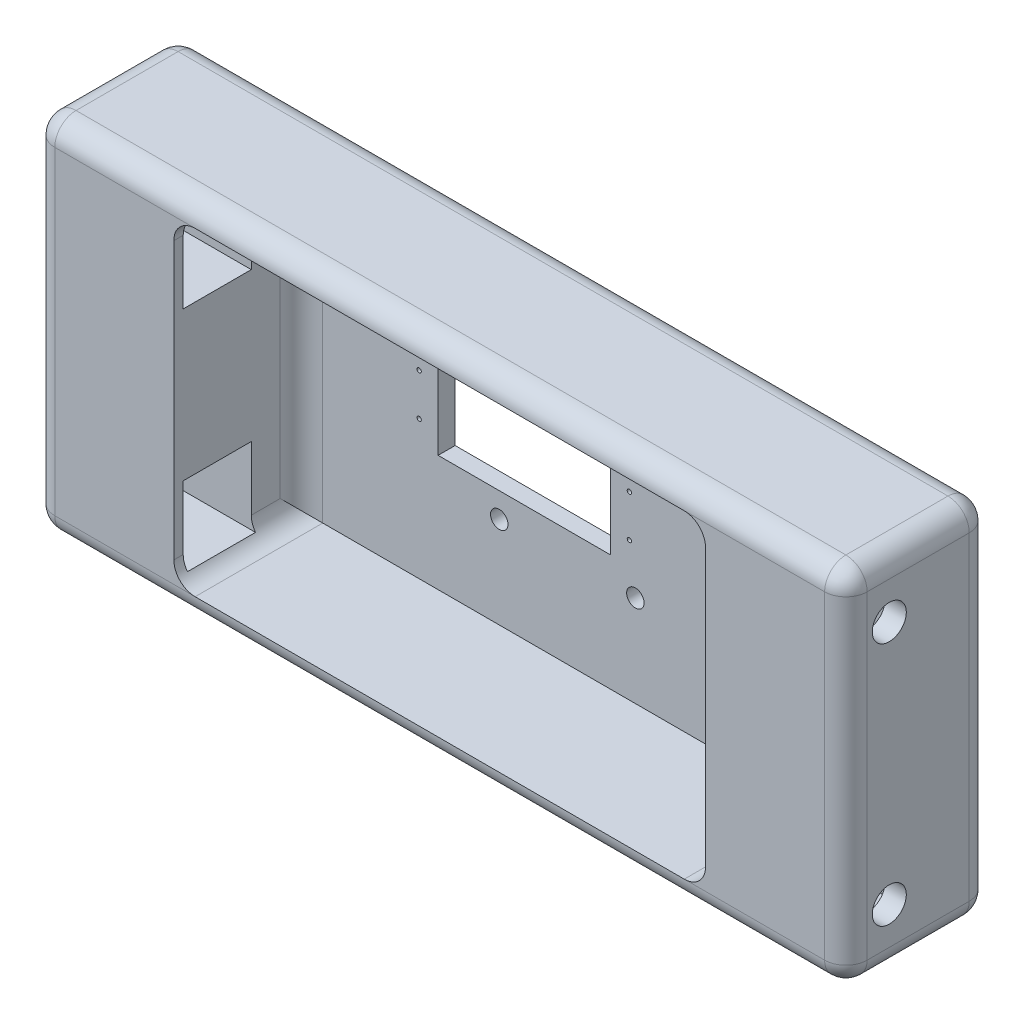
from build123d import *

# Parameters (mm, degrees)
ESBO_O1_W                 = 191
ESBO_O1_H                 = 85
ESBO_O1_W_2               = 125
ESBO_O1_H_2               = 75
RESSALTO_EXTRUS_O1_DEPTH  = 15
CORTE_EXTRUS_O1_REACH     = 198.245
ESBO_O2_R                 = 4
ESBO_O3_W                 = 16
ESBO_O3_H                 = 18
CORTE_EXTRUS_O2_DEPTH     = 28
ESPELHAR3_COPY_1_SKETCH_W = 16
ESPELHAR3_COPY_1_SKETCH_H = 18
ESPELHAR3_COPY_1_DEPTH    = 28
ESBO_O4_W                 = 191
ESBO_O4_H                 = 85
ESBO_O4_R                 = 0.5
ESBO_O4_W_2               = 40.5
ESBO_O4_H_2               = 20.3
RESSALTO_EXTRUS_O5_DEPTH  = 4
FILETE1_R                 = 5
ESBO_O5_R                 = 2.05
CORTE_EXTRUS_O3_DEPTH     = 4


with BuildPart() as part:
    # Esboço1 → Ressalto-extrusão1 (new, symmetric)
    with BuildSketch(Plane.XY):
        Rectangle(ESBO_O1_W, ESBO_O1_H)
        Rectangle(ESBO_O1_W_2, ESBO_O1_H_2, mode=Mode.SUBTRACT)
    extrude(amount=RESSALTO_EXTRUS_O1_DEPTH, both=True)

    # Corte-extrusão1: up to this face of the body (flat: up to its plane)
    corte_extrus_o1_end = Plane(part.part.faces().sort_by_distance((95.5, 0, 0))[0])
    # Esboço2 → Corte-extrusão1 (cut, up to the picked face)
    with BuildSketch(Plane.ZY.offset(95.5), mode=Mode.PRIVATE) as corte_extrus_o1_sk1:
        with Locations((4.8, -28.75)):
            Circle(ESBO_O2_R)
    corte_extrus_o1_tool1 = split(extrude(corte_extrus_o1_sk1.sketch, amount=-CORTE_EXTRUS_O1_REACH, mode=Mode.PRIVATE), bisect_by=corte_extrus_o1_end, keep=Keep.BOTH, mode=Mode.PRIVATE)
    corte_extrus_o1 = corte_extrus_o1_tool1.solids().sort_by(Axis((-95.5, -28.75, 4.8), (1, 0, 0)))[0]
    add(corte_extrus_o1, mode=Mode.SUBTRACT)

    # Esboço3 → Corte-extrusão2 (cut)
    with BuildSketch(Plane(origin=(-62.5, 0, 0), x_dir=(0, 0, -1), z_dir=(1, 0, 0))):
        with Locations((-4.8, -26.5)):
            Rectangle(ESBO_O3_W, ESBO_O3_H)
    corte_extrus_o2 = extrude(amount=-CORTE_EXTRUS_O2_DEPTH, mode=Mode.SUBTRACT)

    # Espelhar1: Corte-extrusão1 across plane
    add(corte_extrus_o1.mirror(Plane.ZX), mode=Mode.SUBTRACT)

    # Espelhar2: Corte-extrusão2 across plane
    add(corte_extrus_o2.mirror(Plane.ZX), mode=Mode.SUBTRACT)

    # Espelhar3: Corte-extrusão2 across plane
    add(corte_extrus_o2.mirror(Plane(origin=(0, 0, 0), x_dir=(0, 0, 1), z_dir=(1, 0, 0))), mode=Mode.SUBTRACT)

    # Espelhar3 copy 1 sketch → Espelhar3 copy 1 (cut)
    with BuildSketch(Plane(origin=(62.5, 0, 0), x_dir=(0, 0, -1), z_dir=(-1, 0, 0))):
        with Locations((-4.8, -26.5)):
            Rectangle(ESPELHAR3_COPY_1_SKETCH_W, ESPELHAR3_COPY_1_SKETCH_H)
    extrude(amount=-ESPELHAR3_COPY_1_DEPTH, mode=Mode.SUBTRACT)

    # Esboço4 → Ressalto-extrusão5 (add)
    with BuildSketch(Plane(origin=(0, 0, -15), x_dir=(-1, 0, 0), z_dir=(0, 0, -1))):
        Rectangle(ESBO_O4_W, ESBO_O4_H)
        with Locations((-14.59, -4.925)):
            Circle(ESBO_O4_R, mode=Mode.SUBTRACT)
        with Locations((34.83, -4.925)):
            Circle(ESBO_O4_R, mode=Mode.SUBTRACT)
        with Locations((34.83, 4.925)):
            Circle(ESBO_O4_R, mode=Mode.SUBTRACT)
        with Locations((-14.59, 4.925)):
            Circle(ESBO_O4_R, mode=Mode.SUBTRACT)
        with Locations((10.12, 0)):
            Rectangle(ESBO_O4_W_2, ESBO_O4_H_2, mode=Mode.SUBTRACT)
    extrude(amount=RESSALTO_EXTRUS_O5_DEPTH)

    # Filete1
    # the kernel refuses this fillet: 5 mm, written as the material it adds along each edge
    with BuildSketch(Plane(origin=(57.5, 32.5, -10), x_dir=(0, 1, 0), z_dir=(0, 0, -1))) as filete1_piece_1_section:
        Polygon((0, 0), (FILETE1_R, 0), (FILETE1_R, FILETE1_R), (0, FILETE1_R), align=None)
    filete1_piece_1 = extrude(amount=FILETE1_R, mode=Mode.PRIVATE)
    filete1_piece_1 = filete1_piece_1 - Plane(origin=(57.5, 32.5, -10), x_dir=(-0.7071067811865475, -0.7071067811865475, 0), z_dir=(0, 0, -1)) * Sphere(FILETE1_R, mode=Mode.PRIVATE)
    add(filete1_piece_1)
    with BuildSketch(Plane(origin=(-57.5, 32.5, -10), x_dir=(0, 1, 0), z_dir=(0, 0, -1))) as filete1_piece_2_section:
        Polygon((0, 0), (FILETE1_R, 0), (FILETE1_R, -FILETE1_R), (0, -FILETE1_R), align=None)
    filete1_piece_2 = extrude(amount=FILETE1_R, mode=Mode.PRIVATE)
    filete1_piece_2 = filete1_piece_2 - Plane(origin=(-57.5, 32.5, -10), x_dir=(0.7071067811865475, -0.7071067811865475, 0), z_dir=(0, 0, -1)) * Sphere(FILETE1_R, mode=Mode.PRIVATE)
    add(filete1_piece_2)
    with BuildSketch(Plane(origin=(62.5, 37.5, -10), x_dir=(0, -1, 0), z_dir=(0, 0, 1))) as filete1_piece_3_section:
        with BuildLine():
            CenterArc((FILETE1_R, -FILETE1_R), FILETE1_R, 90, 90)
            Line((0, -FILETE1_R), (0, 0))
            Line((0, 0), (FILETE1_R, 0))
        make_face()
    filete1_piece_3 = extrude(amount=25, mode=Mode.PRIVATE)
    filete1_piece_3 = split(filete1_piece_3, bisect_by=Plane(origin=(62.288112528, 34.58294172, -3.2), z_dir=(0, 0, -1)), keep=Keep.TOP, mode=Mode.PRIVATE)
    filete1_piece_3 = split(filete1_piece_3, bisect_by=Plane(origin=(62.288112528, 35.5, -6.6), z_dir=(0, -1, 0)), keep=Keep.TOP, mode=Mode.PRIVATE)
    add(filete1_piece_3)
    with BuildSketch(Plane(origin=(62.5, 37.5, -10), x_dir=(0, -1, 0), z_dir=(0, 0, 1))) as filete1_piece_4_section:
        with BuildLine():
            CenterArc((FILETE1_R, -FILETE1_R), FILETE1_R, 90, 90)
            Line((0, -FILETE1_R), (0, 0))
            Line((0, 0), (FILETE1_R, 0))
        make_face()
    filete1_piece_4 = extrude(amount=25, mode=Mode.PRIVATE)
    filete1_piece_4 = split(filete1_piece_4, bisect_by=Plane(origin=(61.14222039, 36.806111701, -3.2), z_dir=(0, 0, -1)), keep=Keep.TOP, mode=Mode.PRIVATE)
    filete1_piece_4 = split(filete1_piece_4, bisect_by=Plane(origin=(61.14222039, 35.5, -6.6), z_dir=(0, 1, 0)), keep=Keep.TOP, mode=Mode.PRIVATE)
    add(filete1_piece_4)
    with BuildSketch(Plane(origin=(62.5, 37.5, -10), x_dir=(0, -1, 0), z_dir=(0, 0, 1))) as filete1_piece_5_section:
        with BuildLine():
            CenterArc((FILETE1_R, -FILETE1_R), FILETE1_R, 90, 90)
            Line((0, -FILETE1_R), (0, 0))
            Line((0, 0), (FILETE1_R, 0))
        make_face()
    filete1_piece_5 = extrude(amount=25, mode=Mode.PRIVATE)
    filete1_piece_5 = split(filete1_piece_5, bisect_by=Plane(origin=(61.14222039, 36.806111701, 12.8), z_dir=(0, 0, -1)), keep=Keep.TOP, mode=Mode.PRIVATE)
    filete1_piece_5 = split(filete1_piece_5, bisect_by=Plane(origin=(61.14222039, 36.806111701, -3.2), z_dir=(0, 0, 1)), keep=Keep.TOP, mode=Mode.PRIVATE)
    filete1_piece_5 = split(filete1_piece_5, bisect_by=Plane(origin=(61.14222039, 35.5, 4.8), z_dir=(0, 1, 0)), keep=Keep.TOP, mode=Mode.PRIVATE)
    add(filete1_piece_5)
    with BuildSketch(Plane(origin=(62.5, 37.5, -10), x_dir=(0, -1, 0), z_dir=(0, 0, 1))) as filete1_piece_6_section:
        with BuildLine():
            CenterArc((FILETE1_R, -FILETE1_R), FILETE1_R, 90, 90)
            Line((0, -FILETE1_R), (0, 0))
            Line((0, 0), (FILETE1_R, 0))
        make_face()
    filete1_piece_6 = extrude(amount=25, mode=Mode.PRIVATE)
    filete1_piece_6 = split(filete1_piece_6, bisect_by=Plane(origin=(62.288112528, 34.58294172, 12.8), z_dir=(0, 0, 1)), keep=Keep.TOP, mode=Mode.PRIVATE)
    filete1_piece_6 = split(filete1_piece_6, bisect_by=Plane(origin=(62.288112528, 35.5, 13.9), z_dir=(0, -1, 0)), keep=Keep.TOP, mode=Mode.PRIVATE)
    add(filete1_piece_6)
    with BuildSketch(Plane(origin=(62.5, 37.5, -10), x_dir=(0, -1, 0), z_dir=(0, 0, 1))) as filete1_piece_7_section:
        with BuildLine():
            CenterArc((FILETE1_R, -FILETE1_R), FILETE1_R, 90, 90)
            Line((0, -FILETE1_R), (0, 0))
            Line((0, 0), (FILETE1_R, 0))
        make_face()
    filete1_piece_7 = extrude(amount=25, mode=Mode.PRIVATE)
    filete1_piece_7 = split(filete1_piece_7, bisect_by=Plane(origin=(61.14222039, 36.806111701, 12.8), z_dir=(0, 0, 1)), keep=Keep.TOP, mode=Mode.PRIVATE)
    filete1_piece_7 = split(filete1_piece_7, bisect_by=Plane(origin=(61.14222039, 35.5, 13.9), z_dir=(0, 1, 0)), keep=Keep.TOP, mode=Mode.PRIVATE)
    add(filete1_piece_7)
    with BuildSketch(Plane(origin=(-62.5, 37.5, -10), x_dir=(1, 0, 0), z_dir=(0, 0, 1))) as filete1_piece_8_section:
        with BuildLine():
            CenterArc((FILETE1_R, -FILETE1_R), FILETE1_R, 90, 90)
            Line((0, -FILETE1_R), (0, 0))
            Line((0, 0), (FILETE1_R, 0))
        make_face()
    filete1_piece_8 = extrude(amount=25, mode=Mode.PRIVATE)
    filete1_piece_8 = split(filete1_piece_8, bisect_by=Plane(origin=(-61.14222039, 35.5, -6.6), z_dir=(0, 1, 0)), keep=Keep.TOP, mode=Mode.PRIVATE)
    filete1_piece_8 = split(filete1_piece_8, bisect_by=Plane(origin=(-61.14222039, 36.806111701, -3.2), z_dir=(0, 0, -1)), keep=Keep.TOP, mode=Mode.PRIVATE)
    add(filete1_piece_8)
    with BuildSketch(Plane(origin=(-62.5, 37.5, -10), x_dir=(1, 0, 0), z_dir=(0, 0, 1))) as filete1_piece_9_section:
        with BuildLine():
            CenterArc((FILETE1_R, -FILETE1_R), FILETE1_R, 90, 90)
            Line((0, -FILETE1_R), (0, 0))
            Line((0, 0), (FILETE1_R, 0))
        make_face()
    filete1_piece_9 = extrude(amount=25, mode=Mode.PRIVATE)
    filete1_piece_9 = split(filete1_piece_9, bisect_by=Plane(origin=(-62.288112528, 35.5, -6.6), z_dir=(0, -1, 0)), keep=Keep.TOP, mode=Mode.PRIVATE)
    filete1_piece_9 = split(filete1_piece_9, bisect_by=Plane(origin=(-62.288112528, 34.58294172, -3.2), z_dir=(0, 0, -1)), keep=Keep.TOP, mode=Mode.PRIVATE)
    add(filete1_piece_9)
    with BuildSketch(Plane(origin=(-62.5, 37.5, -10), x_dir=(1, 0, 0), z_dir=(0, 0, 1))) as filete1_piece_10_section:
        with BuildLine():
            CenterArc((FILETE1_R, -FILETE1_R), FILETE1_R, 90, 90)
            Line((0, -FILETE1_R), (0, 0))
            Line((0, 0), (FILETE1_R, 0))
        make_face()
    filete1_piece_10 = extrude(amount=25, mode=Mode.PRIVATE)
    filete1_piece_10 = split(filete1_piece_10, bisect_by=Plane(origin=(-61.14222039, 35.5, 4.8), z_dir=(0, 1, 0)), keep=Keep.TOP, mode=Mode.PRIVATE)
    filete1_piece_10 = split(filete1_piece_10, bisect_by=Plane(origin=(-61.14222039, 36.806111701, -3.2), z_dir=(0, 0, 1)), keep=Keep.TOP, mode=Mode.PRIVATE)
    filete1_piece_10 = split(filete1_piece_10, bisect_by=Plane(origin=(-61.14222039, 36.806111701, 12.8), z_dir=(0, 0, -1)), keep=Keep.TOP, mode=Mode.PRIVATE)
    add(filete1_piece_10)
    with BuildSketch(Plane(origin=(-62.5, 37.5, -10), x_dir=(1, 0, 0), z_dir=(0, 0, 1))) as filete1_piece_11_section:
        with BuildLine():
            CenterArc((FILETE1_R, -FILETE1_R), FILETE1_R, 90, 90)
            Line((0, -FILETE1_R), (0, 0))
            Line((0, 0), (FILETE1_R, 0))
        make_face()
    filete1_piece_11 = extrude(amount=25, mode=Mode.PRIVATE)
    filete1_piece_11 = split(filete1_piece_11, bisect_by=Plane(origin=(-61.14222039, 35.5, 13.9), z_dir=(0, 1, 0)), keep=Keep.TOP, mode=Mode.PRIVATE)
    filete1_piece_11 = split(filete1_piece_11, bisect_by=Plane(origin=(-61.14222039, 36.806111701, 12.8), z_dir=(0, 0, 1)), keep=Keep.TOP, mode=Mode.PRIVATE)
    add(filete1_piece_11)
    with BuildSketch(Plane(origin=(-62.5, 37.5, -10), x_dir=(1, 0, 0), z_dir=(0, 0, 1))) as filete1_piece_12_section:
        with BuildLine():
            CenterArc((FILETE1_R, -FILETE1_R), FILETE1_R, 90, 90)
            Line((0, -FILETE1_R), (0, 0))
            Line((0, 0), (FILETE1_R, 0))
        make_face()
    filete1_piece_12 = extrude(amount=25, mode=Mode.PRIVATE)
    filete1_piece_12 = split(filete1_piece_12, bisect_by=Plane(origin=(-62.288112528, 35.5, 13.9), z_dir=(0, -1, 0)), keep=Keep.TOP, mode=Mode.PRIVATE)
    filete1_piece_12 = split(filete1_piece_12, bisect_by=Plane(origin=(-62.288112528, 34.58294172, 12.8), z_dir=(0, 0, 1)), keep=Keep.TOP, mode=Mode.PRIVATE)
    add(filete1_piece_12)
    with BuildSketch(Plane(origin=(57.5, 37.5, -15), x_dir=(0, 0, 1), z_dir=(-1, 0, 0))) as filete1_piece_13:
        with BuildLine():
            CenterArc((FILETE1_R, -FILETE1_R), FILETE1_R, 90, 90)
            Line((0, -FILETE1_R), (0, 0))
            Line((0, 0), (FILETE1_R, 0))
        make_face()
    extrude(amount=115)
    with BuildSketch(Plane(origin=(-62.5, 32.5, -15), x_dir=(0, 0, 1), z_dir=(0, -1, 0)), Plane(origin=(62.5, -37.5, -15), x_dir=(0, 0, 1), z_dir=(0, 1, 0))) as filete1_piece_14:
        with BuildLine():
            CenterArc((FILETE1_R, -FILETE1_R), FILETE1_R, 90, 90)
            Line((0, -FILETE1_R), (0, 0))
            Line((0, 0), (FILETE1_R, 0))
        make_face()
    extrude(amount=70)
    with BuildSketch(Plane(origin=(62.5, -37.5, -15), x_dir=(0, 1, 0), z_dir=(0, 0, 1))) as filete1_piece_15_section:
        with BuildLine():
            CenterArc((FILETE1_R, FILETE1_R), FILETE1_R, 180, 90)
            Line((0, FILETE1_R), (0, 0))
            Line((0, 0), (FILETE1_R, 0))
        make_face()
    filete1_piece_15 = extrude(amount=30, mode=Mode.PRIVATE)
    filete1_piece_15 = split(filete1_piece_15, bisect_by=Plane(origin=(62.288112528, -35.5, -9.1), z_dir=(0, 1, 0)), keep=Keep.TOP, mode=Mode.PRIVATE)
    filete1_piece_15 = split(filete1_piece_15, bisect_by=Plane(origin=(62.288112528, -34.58294172, -3.2), z_dir=(0, 0, -1)), keep=Keep.TOP, mode=Mode.PRIVATE)
    add(filete1_piece_15)
    with BuildSketch(Plane(origin=(62.5, -37.5, -15), x_dir=(0, 1, 0), z_dir=(0, 0, 1))) as filete1_piece_16_section:
        with BuildLine():
            CenterArc((FILETE1_R, FILETE1_R), FILETE1_R, 180, 90)
            Line((0, FILETE1_R), (0, 0))
            Line((0, 0), (FILETE1_R, 0))
        make_face()
    filete1_piece_16 = extrude(amount=30, mode=Mode.PRIVATE)
    filete1_piece_16 = split(filete1_piece_16, bisect_by=Plane(origin=(61.14222039, -35.5, -9.1), z_dir=(0, -1, 0)), keep=Keep.TOP, mode=Mode.PRIVATE)
    filete1_piece_16 = split(filete1_piece_16, bisect_by=Plane(origin=(61.14222039, -36.806111701, -3.2), z_dir=(0, 0, -1)), keep=Keep.TOP, mode=Mode.PRIVATE)
    add(filete1_piece_16)
    with BuildSketch(Plane(origin=(62.5, -37.5, -15), x_dir=(0, 1, 0), z_dir=(0, 0, 1))) as filete1_piece_17_section:
        with BuildLine():
            CenterArc((FILETE1_R, FILETE1_R), FILETE1_R, 180, 90)
            Line((0, FILETE1_R), (0, 0))
            Line((0, 0), (FILETE1_R, 0))
        make_face()
    filete1_piece_17 = extrude(amount=30, mode=Mode.PRIVATE)
    filete1_piece_17 = split(filete1_piece_17, bisect_by=Plane(origin=(61.14222039, -35.5, 4.8), z_dir=(0, -1, 0)), keep=Keep.TOP, mode=Mode.PRIVATE)
    filete1_piece_17 = split(filete1_piece_17, bisect_by=Plane(origin=(61.14222039, -36.806111701, 12.8), z_dir=(0, 0, -1)), keep=Keep.TOP, mode=Mode.PRIVATE)
    filete1_piece_17 = split(filete1_piece_17, bisect_by=Plane(origin=(61.14222039, -36.806111701, -3.2), z_dir=(0, 0, 1)), keep=Keep.TOP, mode=Mode.PRIVATE)
    add(filete1_piece_17)
    with BuildSketch(Plane(origin=(62.5, -37.5, -15), x_dir=(0, 1, 0), z_dir=(0, 0, 1))) as filete1_piece_18_section:
        with BuildLine():
            CenterArc((FILETE1_R, FILETE1_R), FILETE1_R, 180, 90)
            Line((0, FILETE1_R), (0, 0))
            Line((0, 0), (FILETE1_R, 0))
        make_face()
    filete1_piece_18 = extrude(amount=30, mode=Mode.PRIVATE)
    filete1_piece_18 = split(filete1_piece_18, bisect_by=Plane(origin=(62.288112528, -35.5, 13.9), z_dir=(0, 1, 0)), keep=Keep.TOP, mode=Mode.PRIVATE)
    filete1_piece_18 = split(filete1_piece_18, bisect_by=Plane(origin=(62.288112528, -34.58294172, 12.8), z_dir=(0, 0, 1)), keep=Keep.TOP, mode=Mode.PRIVATE)
    add(filete1_piece_18)
    with BuildSketch(Plane(origin=(62.5, -37.5, -15), x_dir=(0, 1, 0), z_dir=(0, 0, 1))) as filete1_piece_19_section:
        with BuildLine():
            CenterArc((FILETE1_R, FILETE1_R), FILETE1_R, 180, 90)
            Line((0, FILETE1_R), (0, 0))
            Line((0, 0), (FILETE1_R, 0))
        make_face()
    filete1_piece_19 = extrude(amount=30, mode=Mode.PRIVATE)
    filete1_piece_19 = split(filete1_piece_19, bisect_by=Plane(origin=(61.14222039, -35.5, 13.9), z_dir=(0, -1, 0)), keep=Keep.TOP, mode=Mode.PRIVATE)
    filete1_piece_19 = split(filete1_piece_19, bisect_by=Plane(origin=(61.14222039, -36.806111701, 12.8), z_dir=(0, 0, 1)), keep=Keep.TOP, mode=Mode.PRIVATE)
    add(filete1_piece_19)
    with BuildSketch(Plane(origin=(-62.5, -37.5, 15), x_dir=(0, 1, 0), z_dir=(0, 0, -1))) as filete1_piece_20_section:
        with BuildLine():
            CenterArc((FILETE1_R, FILETE1_R), FILETE1_R, 180, 90)
            Line((0, FILETE1_R), (0, 0))
            Line((0, 0), (FILETE1_R, 0))
        make_face()
    filete1_piece_20 = extrude(amount=30, mode=Mode.PRIVATE)
    filete1_piece_20 = split(filete1_piece_20, bisect_by=Plane(origin=(-62.288112528, -34.58294172, 12.8), z_dir=(0, 0, 1)), keep=Keep.TOP, mode=Mode.PRIVATE)
    filete1_piece_20 = split(filete1_piece_20, bisect_by=Plane(origin=(-62.288112528, -35.5, 13.9), z_dir=(0, 1, 0)), keep=Keep.TOP, mode=Mode.PRIVATE)
    add(filete1_piece_20)
    with BuildSketch(Plane(origin=(-62.5, -37.5, 15), x_dir=(0, 1, 0), z_dir=(0, 0, -1))) as filete1_piece_21_section:
        with BuildLine():
            CenterArc((FILETE1_R, FILETE1_R), FILETE1_R, 180, 90)
            Line((0, FILETE1_R), (0, 0))
            Line((0, 0), (FILETE1_R, 0))
        make_face()
    filete1_piece_21 = extrude(amount=30, mode=Mode.PRIVATE)
    filete1_piece_21 = split(filete1_piece_21, bisect_by=Plane(origin=(-61.14222039, -36.806111701, 12.8), z_dir=(0, 0, 1)), keep=Keep.TOP, mode=Mode.PRIVATE)
    filete1_piece_21 = split(filete1_piece_21, bisect_by=Plane(origin=(-61.14222039, -35.5, 13.9), z_dir=(0, -1, 0)), keep=Keep.TOP, mode=Mode.PRIVATE)
    add(filete1_piece_21)
    with BuildSketch(Plane(origin=(-62.5, -37.5, 15), x_dir=(0, 1, 0), z_dir=(0, 0, -1))) as filete1_piece_22_section:
        with BuildLine():
            CenterArc((FILETE1_R, FILETE1_R), FILETE1_R, 180, 90)
            Line((0, FILETE1_R), (0, 0))
            Line((0, 0), (FILETE1_R, 0))
        make_face()
    filete1_piece_22 = extrude(amount=30, mode=Mode.PRIVATE)
    filete1_piece_22 = split(filete1_piece_22, bisect_by=Plane(origin=(-61.14222039, -36.806111701, 12.8), z_dir=(0, 0, -1)), keep=Keep.TOP, mode=Mode.PRIVATE)
    filete1_piece_22 = split(filete1_piece_22, bisect_by=Plane(origin=(-61.14222039, -35.5, 4.8), z_dir=(0, -1, 0)), keep=Keep.TOP, mode=Mode.PRIVATE)
    filete1_piece_22 = split(filete1_piece_22, bisect_by=Plane(origin=(-61.14222039, -36.806111701, -3.2), z_dir=(0, 0, 1)), keep=Keep.TOP, mode=Mode.PRIVATE)
    add(filete1_piece_22)
    with BuildSketch(Plane(origin=(-62.5, -37.5, 15), x_dir=(0, 1, 0), z_dir=(0, 0, -1))) as filete1_piece_23_section:
        with BuildLine():
            CenterArc((FILETE1_R, FILETE1_R), FILETE1_R, 180, 90)
            Line((0, FILETE1_R), (0, 0))
            Line((0, 0), (FILETE1_R, 0))
        make_face()
    filete1_piece_23 = extrude(amount=30, mode=Mode.PRIVATE)
    filete1_piece_23 = split(filete1_piece_23, bisect_by=Plane(origin=(-62.288112528, -35.5, -9.1), z_dir=(0, 1, 0)), keep=Keep.TOP, mode=Mode.PRIVATE)
    filete1_piece_23 = split(filete1_piece_23, bisect_by=Plane(origin=(-62.288112528, -34.58294172, -3.2), z_dir=(0, 0, -1)), keep=Keep.TOP, mode=Mode.PRIVATE)
    add(filete1_piece_23)
    with BuildSketch(Plane(origin=(-62.5, -37.5, 15), x_dir=(0, 1, 0), z_dir=(0, 0, -1))) as filete1_piece_24_section:
        with BuildLine():
            CenterArc((FILETE1_R, FILETE1_R), FILETE1_R, 180, 90)
            Line((0, FILETE1_R), (0, 0))
            Line((0, 0), (FILETE1_R, 0))
        make_face()
    filete1_piece_24 = extrude(amount=30, mode=Mode.PRIVATE)
    filete1_piece_24 = split(filete1_piece_24, bisect_by=Plane(origin=(-61.14222039, -35.5, -9.1), z_dir=(0, -1, 0)), keep=Keep.TOP, mode=Mode.PRIVATE)
    filete1_piece_24 = split(filete1_piece_24, bisect_by=Plane(origin=(-61.14222039, -36.806111701, -3.2), z_dir=(0, 0, -1)), keep=Keep.TOP, mode=Mode.PRIVATE)
    add(filete1_piece_24)
    # the kernel refuses this fillet: 5 mm, written as the material it takes off along each edge
    with BuildSketch(Plane(origin=(90.5, -37.5, 10), x_dir=(1, 0, 0), z_dir=(0, -1, 0))) as filete1_2_piece_1_section:
        Polygon((0, 0), (FILETE1_R, 0), (FILETE1_R, FILETE1_R), (0, FILETE1_R), align=None)
    filete1_2_piece_1 = extrude(amount=FILETE1_R, mode=Mode.PRIVATE)
    filete1_2_piece_1 = filete1_2_piece_1 - Plane(origin=(90.5, -37.5, 10), x_dir=(-0.7071067811865475, 0, -0.7071067811865475), z_dir=(0, -1, 0)) * Sphere(FILETE1_R, mode=Mode.PRIVATE)
    add(filete1_2_piece_1, mode=Mode.SUBTRACT)
    with BuildSketch(Plane(origin=(90.5, 37.5, 10), x_dir=(1, 0, 0), z_dir=(0, 1, 0))) as filete1_2_piece_2_section:
        Polygon((0, 0), (FILETE1_R, 0), (FILETE1_R, -FILETE1_R), (0, -FILETE1_R), align=None)
    filete1_2_piece_2 = extrude(amount=FILETE1_R, mode=Mode.PRIVATE)
    filete1_2_piece_2 = filete1_2_piece_2 - Plane(origin=(90.5, 37.5, 10), x_dir=(-0.7071067811865475, 0, -0.7071067811865475), z_dir=(0, 1, 0)) * Sphere(FILETE1_R, mode=Mode.PRIVATE)
    add(filete1_2_piece_2, mode=Mode.SUBTRACT)
    with BuildSketch(Plane(origin=(-90.5, 37.5, 10), x_dir=(-1, 0, 0), z_dir=(0, 1, 0))) as filete1_2_piece_3_section:
        Polygon((0, 0), (FILETE1_R, 0), (FILETE1_R, FILETE1_R), (0, FILETE1_R), align=None)
    filete1_2_piece_3 = extrude(amount=FILETE1_R, mode=Mode.PRIVATE)
    filete1_2_piece_3 = filete1_2_piece_3 - Plane(origin=(-90.5, 37.5, 10), x_dir=(0.7071067811865475, 0, -0.7071067811865475), z_dir=(0, 1, 0)) * Sphere(FILETE1_R, mode=Mode.PRIVATE)
    add(filete1_2_piece_3, mode=Mode.SUBTRACT)
    with BuildSketch(Plane(origin=(-90.5, -37.5, 10), x_dir=(-1, 0, 0), z_dir=(0, -1, 0))) as filete1_2_piece_4_section:
        Polygon((0, 0), (FILETE1_R, 0), (FILETE1_R, -FILETE1_R), (0, -FILETE1_R), align=None)
    filete1_2_piece_4 = extrude(amount=FILETE1_R, mode=Mode.PRIVATE)
    filete1_2_piece_4 = filete1_2_piece_4 - Plane(origin=(-90.5, -37.5, 10), x_dir=(0.7071067811865475, 0, -0.7071067811865475), z_dir=(0, -1, 0)) * Sphere(FILETE1_R, mode=Mode.PRIVATE)
    add(filete1_2_piece_4, mode=Mode.SUBTRACT)
    with BuildSketch(Plane(origin=(90.5, -37.5, -14), x_dir=(1, 0, 0), z_dir=(0, -1, 0))) as filete1_2_piece_5_section:
        Polygon((0, 0), (FILETE1_R, 0), (FILETE1_R, -FILETE1_R), (0, -FILETE1_R), align=None)
    filete1_2_piece_5 = extrude(amount=FILETE1_R, mode=Mode.PRIVATE)
    filete1_2_piece_5 = filete1_2_piece_5 - Plane(origin=(90.5, -37.5, -14), x_dir=(-0.7071067811865475, 0, 0.7071067811865475), z_dir=(0, -1, 0)) * Sphere(FILETE1_R, mode=Mode.PRIVATE)
    add(filete1_2_piece_5, mode=Mode.SUBTRACT)
    with BuildSketch(Plane(origin=(90.5, 37.5, -14), x_dir=(1, 0, 0), z_dir=(0, 1, 0))) as filete1_2_piece_6_section:
        Polygon((0, 0), (FILETE1_R, 0), (FILETE1_R, FILETE1_R), (0, FILETE1_R), align=None)
    filete1_2_piece_6 = extrude(amount=FILETE1_R, mode=Mode.PRIVATE)
    filete1_2_piece_6 = filete1_2_piece_6 - Plane(origin=(90.5, 37.5, -14), x_dir=(-0.7071067811865475, 0, 0.7071067811865475), z_dir=(0, 1, 0)) * Sphere(FILETE1_R, mode=Mode.PRIVATE)
    add(filete1_2_piece_6, mode=Mode.SUBTRACT)
    with BuildSketch(Plane(origin=(-90.5, -37.5, -14), x_dir=(0, 0, -1), z_dir=(0, -1, 0))) as filete1_2_piece_7_section:
        Polygon((0, 0), (FILETE1_R, 0), (FILETE1_R, -FILETE1_R), (0, -FILETE1_R), align=None)
    filete1_2_piece_7 = extrude(amount=FILETE1_R, mode=Mode.PRIVATE)
    filete1_2_piece_7 = filete1_2_piece_7 - Plane(origin=(-90.5, -37.5, -14), x_dir=(0.7071067811865475, 0, 0.7071067811865475), z_dir=(0, -1, 0)) * Sphere(FILETE1_R, mode=Mode.PRIVATE)
    add(filete1_2_piece_7, mode=Mode.SUBTRACT)
    with BuildSketch(Plane(origin=(-90.5, 37.5, -14), x_dir=(0, 0, -1), z_dir=(0, 1, 0))) as filete1_2_piece_8_section:
        Polygon((0, 0), (FILETE1_R, 0), (FILETE1_R, FILETE1_R), (0, FILETE1_R), align=None)
    filete1_2_piece_8 = extrude(amount=FILETE1_R, mode=Mode.PRIVATE)
    filete1_2_piece_8 = filete1_2_piece_8 - Plane(origin=(-90.5, 37.5, -14), x_dir=(0.7071067811865475, 0, 0.7071067811865475), z_dir=(0, 1, 0)) * Sphere(FILETE1_R, mode=Mode.PRIVATE)
    add(filete1_2_piece_8, mode=Mode.SUBTRACT)
    with BuildSketch(Plane(origin=(95.5, -37.5, 15), x_dir=(0, 0, -1), z_dir=(0, 1, 0)), Plane(origin=(-95.5, 37.5, 15), x_dir=(0, 0, -1), z_dir=(0, -1, 0)), Plane(origin=(-95.5, 37.5, -19), x_dir=(1, 0, 0), z_dir=(0, -1, 0))) as filete1_2_piece_9:
        with BuildLine():
            CenterArc((FILETE1_R, FILETE1_R), FILETE1_R, 180, 90)
            Line((0, FILETE1_R), (0, 0))
            Line((0, 0), (FILETE1_R, 0))
        make_face()
    extrude(amount=75, mode=Mode.SUBTRACT)
    with BuildSketch(Plane(origin=(95.5, -37.5, -19), x_dir=(0, 0, 1), z_dir=(0, 1, 0))) as filete1_2_piece_10:
        with BuildLine():
            CenterArc((FILETE1_R, -FILETE1_R), FILETE1_R, 90, 90)
            Line((0, -FILETE1_R), (0, 0))
            Line((0, 0), (FILETE1_R, 0))
        make_face()
    extrude(amount=75, mode=Mode.SUBTRACT)
    with BuildSketch(Plane(origin=(-90.5, -42.5, -19), x_dir=(0, 0, 1), z_dir=(1, 0, 0)), Plane(origin=(90.5, 42.5, -19), x_dir=(0, 0, 1), z_dir=(-1, 0, 0))) as filete1_2_piece_11:
        with BuildLine():
            CenterArc((FILETE1_R, -FILETE1_R), FILETE1_R, 90, 90)
            Line((0, -FILETE1_R), (0, 0))
            Line((0, 0), (FILETE1_R, 0))
        make_face()
    extrude(amount=181, mode=Mode.SUBTRACT)
    with BuildSketch(Plane(origin=(-95.5, -42.5, 10), x_dir=(1, 0, 0), z_dir=(0, 0, -1)), Plane(origin=(95.5, -42.5, -14), x_dir=(-1, 0, 0), z_dir=(0, 0, 1)), Plane(origin=(95.5, 42.5, -14), x_dir=(0, -1, 0), z_dir=(0, 0, 1))) as filete1_2_piece_12:
        with BuildLine():
            CenterArc((FILETE1_R, -FILETE1_R), FILETE1_R, 90, 90)
            Line((0, -FILETE1_R), (0, 0))
            Line((0, 0), (FILETE1_R, 0))
        make_face()
    extrude(amount=24, mode=Mode.SUBTRACT)
    with BuildSketch(Plane(origin=(-95.5, 42.5, 10), x_dir=(1, 0, 0), z_dir=(0, 0, -1))) as filete1_2_piece_13:
        with BuildLine():
            CenterArc((FILETE1_R, FILETE1_R), FILETE1_R, 180, 90)
            Line((0, FILETE1_R), (0, 0))
            Line((0, 0), (FILETE1_R, 0))
        make_face()
    extrude(amount=24, mode=Mode.SUBTRACT)
    with BuildSketch(Plane(origin=(-90.5, -42.5, 15), x_dir=(0, 0, -1), z_dir=(1, 0, 0)), Plane(origin=(90.5, 42.5, 15), x_dir=(0, 0, -1), z_dir=(-1, 0, 0))) as filete1_2_piece_14:
        with BuildLine():
            CenterArc((FILETE1_R, FILETE1_R), FILETE1_R, 180, 90)
            Line((0, FILETE1_R), (0, 0))
            Line((0, 0), (FILETE1_R, 0))
        make_face()
    extrude(amount=181, mode=Mode.SUBTRACT)

    # Esboço5 → Corte-extrusão3 (cut)
    with BuildSketch(Plane(origin=(0, 0, -19), x_dir=(-1, 0, 0), z_dir=(0, 0, -1))):
        with Locations((-16, 16)):
            Circle(ESBO_O5_R)
        with Locations((16, 16)):
            Circle(ESBO_O5_R)
        with Locations((16, -16)):
            Circle(ESBO_O5_R)
        with Locations((-16, -16)):
            Circle(ESBO_O5_R)
    extrude(amount=-CORTE_EXTRUS_O3_DEPTH, mode=Mode.SUBTRACT)


solid = part.part
